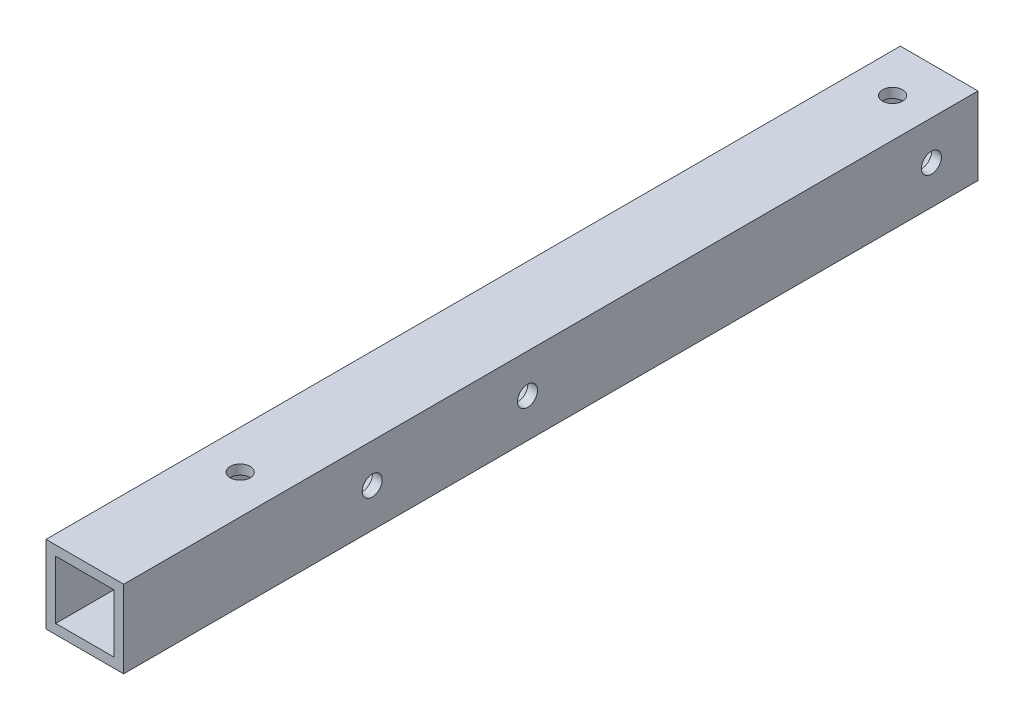
from build123d import *

# Parameters (mm, degrees)
SKETCH2_W           = 25.4
SKETCH2_H           = 25.4
BOSS_EXTRUDE1_DEPTH = 279.4
SKETCH4_W           = 19.05
SKETCH4_H           = 19.05
CUT_EXTRUDE1_DEPTH  = 280.9766776
SKETCH5_R           = 3.2639
CUT_EXTRUDE2_DEPTH  = 281.839473721
SKETCH6_R           = 3.2639
CUT_EXTRUDE3_DEPTH  = 281.839473721
SKETCH7_R           = 3.2639
CUT_EXTRUDE4_DEPTH  = 281.839473721
SKETCH8_R           = 3.2639
CUT_EXTRUDE5_DEPTH  = 281.839473721


with BuildPart() as part:
    # Sketch2 → Boss-Extrude1 (new body)
    with BuildSketch(Plane.XY):
        Rectangle(SKETCH2_W, SKETCH2_H)
    extrude(amount=BOSS_EXTRUDE1_DEPTH)

    # Sketch4 → Cut-Extrude1 (cut, through all)
    with BuildSketch(Plane.XY):
        Rectangle(SKETCH4_W, SKETCH4_H)
    extrude(amount=CUT_EXTRUDE1_DEPTH, mode=Mode.SUBTRACT)

    # Sketch5 → Cut-Extrude2 (cut, through all)
    with BuildSketch(Plane(origin=(0, 12.7, 0), x_dir=(1, 0, 0), z_dir=(0, 1, 0))):
        with Locations((0, -15.24)):
            Circle(SKETCH5_R)
    extrude(amount=-CUT_EXTRUDE2_DEPTH, mode=Mode.SUBTRACT)

    # Sketch6 → Cut-Extrude3 (cut, through all)
    with BuildSketch(Plane(origin=(0, 12.7, 0), x_dir=(1, 0, 0), z_dir=(0, 1, 0))):
        with Locations((0, -228.6)):
            Circle(SKETCH6_R)
    extrude(amount=-CUT_EXTRUDE3_DEPTH, mode=Mode.SUBTRACT)

    # Sketch7 → Cut-Extrude4 (cut, through all)
    with BuildSketch(Plane.ZY.offset(12.7)):
        with Locations((15.24, 0)):
            Circle(SKETCH7_R)
    extrude(amount=-CUT_EXTRUDE4_DEPTH, mode=Mode.SUBTRACT)

    # Sketch8 → Cut-Extrude5 (cut, through all)
    with BuildSketch(Plane.ZY.offset(12.7)):
        with Locations((198.12, 0)):
            Circle(SKETCH8_R)
        with Locations((147.32, 0)):
            Circle(SKETCH8_R)
    extrude(amount=-CUT_EXTRUDE5_DEPTH, mode=Mode.SUBTRACT)


solid = part.part
